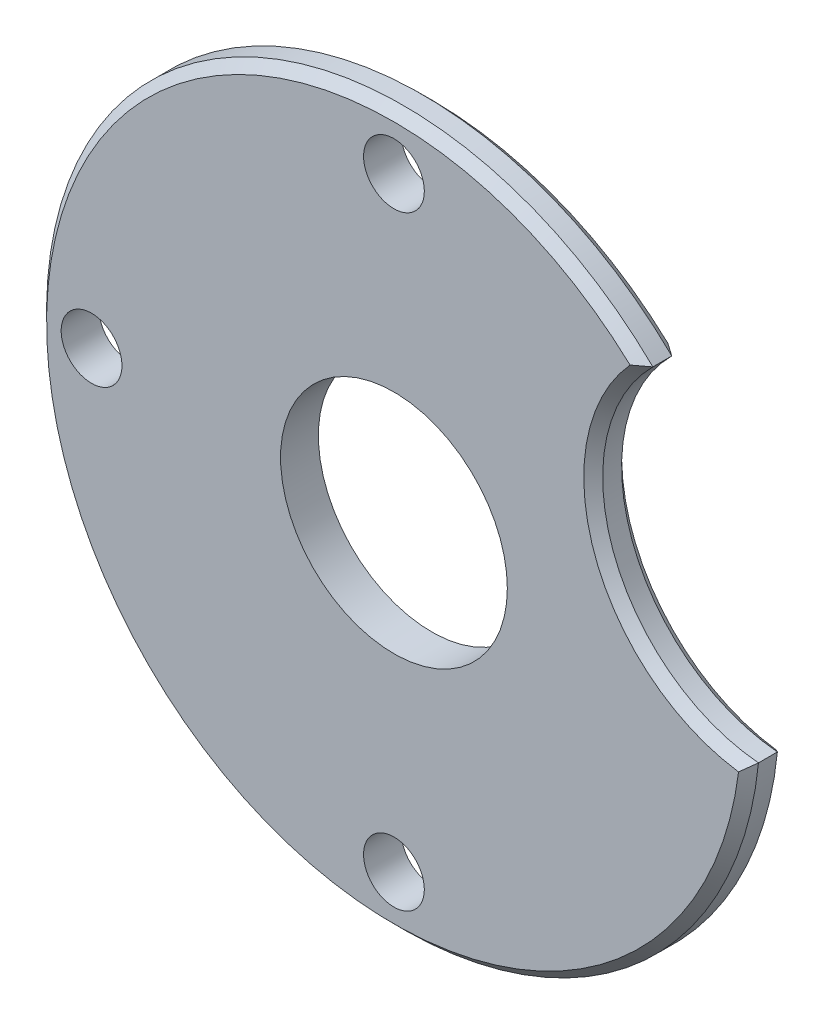
from build123d import *

# Parameters (mm, degrees)
SKETCH1_R           = 2.5527
SKETCH1_R_2         = 9.525
BOSS_EXTRUDE1_DEPTH = 3.175
CHAMFER1_SIZE       = 0.79375
CHAMFER2_SIZE       = 0.79375


with BuildPart() as part:
    # Sketch1 → Boss-Extrude1 (new body)
    with BuildSketch(Plane.XY):
        with BuildLine():
            ThreePointArc((29.827123218, -2.94338318), (17.602792019, 6.406892335), (20.956931757, 21.427267566))
            ThreePointArc((20.956931757, 21.427267566), (-28.16446723, -10.251027736), (29.827123218, -2.94338318))
        make_face()
        with Locations((0, -25.4)):
            Circle(SKETCH1_R, mode=Mode.SUBTRACT)
        with Locations((-25.4, 0)):
            Circle(SKETCH1_R, mode=Mode.SUBTRACT)
        Circle(SKETCH1_R_2, mode=Mode.SUBTRACT)
        with Locations((0, 25.4)):
            Circle(SKETCH1_R, mode=Mode.SUBTRACT)
    extrude(amount=BOSS_EXTRUDE1_DEPTH)

    # Chamfer1
    chamfer1_edges = [part.edges().sort_by_distance(p)[0] for p in [
        (17.602792019, 6.406892335, 3.175),
        (-28.16446723, -10.251027736, 3.175),
    ]]
    chamfer(chamfer1_edges, length=CHAMFER1_SIZE)

    # Chamfer2
    chamfer2_edges = [part.edges().sort_by_distance(p)[0] for p in [
        (17.602792019, 6.406892335, 0),
        (-28.16446723, -10.251027736, 0),
    ]]
    chamfer(chamfer2_edges, length=CHAMFER2_SIZE)


solid = part.part
